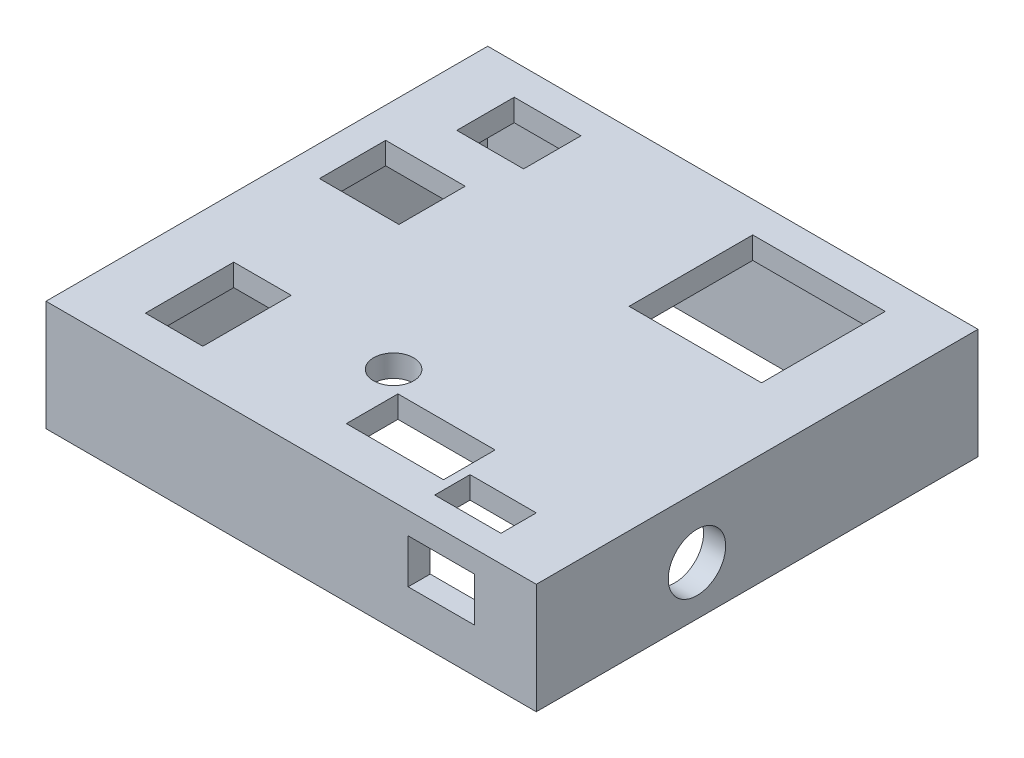
from build123d import *

# Parameters (mm, degrees)
SKETCH1_W           = 111
SKETCH1_H           = 100
BOSS_EXTRUDE1_DEPTH = 25
SKETCH2_W           = 101
SKETCH2_H           = 90
CUT_EXTRUDE1_DEPTH  = 20
SKETCH3_W           = 22
SKETCH3_H           = 11.672445945
CUT_EXTRUDE2_DEPTH  = 20
SKETCH4_W           = 15
SKETCH4_H           = 8
CUT_EXTRUDE3_DEPTH  = 20
SKETCH5_W           = 18
SKETCH5_H           = 15
CUT_EXTRUDE4_DEPTH  = 20
SKETCH6_W           = 15.121270519
SKETCH6_H           = 13
CUT_EXTRUDE5_DEPTH  = 20
SKETCH7_W           = 30
SKETCH7_H           = 28
CUT_EXTRUDE6_DEPTH  = 20
SKETCH8_R           = 4.533684
CUT_EXTRUDE7_DEPTH  = 20
SKETCH9_W           = 13
SKETCH9_H           = 20
CUT_EXTRUDE8_DEPTH  = 20
SKETCH10_R          = 6.5
CUT_EXTRUDE10_DEPTH = 20
SKETCH11_W          = 15.022741717
SKETCH11_H          = 10
CUT_EXTRUDE11_DEPTH = 20


with BuildPart() as part:
    # Sketch1 → Boss-Extrude1 (new body)
    with BuildSketch(Plane(origin=(0, 0, 0), x_dir=(1, 0, 0), z_dir=(0, 1, 0))):
        with Locations((-42.348341232, -8.130331754)):
            Rectangle(SKETCH1_W, SKETCH1_H)
    extrude(amount=BOSS_EXTRUDE1_DEPTH)

    # Sketch2 → Cut-Extrude1 (cut)
    with BuildSketch(Plane.XZ):
        with Locations((-42.348341232, 8.130331754)):
            Rectangle(SKETCH2_W, SKETCH2_H)
    extrude(amount=-CUT_EXTRUDE1_DEPTH, mode=Mode.SUBTRACT)

    # Sketch3 → Cut-Extrude2 (cut)
    with BuildSketch(Plane.XZ.offset(-20)):
        with Locations((-28.848341232, 42.294108782)):
            Rectangle(SKETCH3_W, SKETCH3_H)
    extrude(amount=-CUT_EXTRUDE2_DEPTH, mode=Mode.SUBTRACT)

    # Sketch4 → Cut-Extrude3 (cut)
    with BuildSketch(Plane.XZ.offset(-20)):
        with Locations((-8.348341232, 48.130331754)):
            Rectangle(SKETCH4_W, SKETCH4_H)
    extrude(amount=-CUT_EXTRUDE3_DEPTH, mode=Mode.SUBTRACT)

    # Sketch5 → Cut-Extrude4 (cut)
    with BuildSketch(Plane(origin=(0, 20, 0), x_dir=(-1, 0, 0), z_dir=(0, -1, 0))):
        with Locations((81.940531526, 4.369668246)):
            Rectangle(SKETCH5_W, SKETCH5_H)
    extrude(amount=-CUT_EXTRUDE4_DEPTH, mode=Mode.SUBTRACT)

    # Sketch6 → Cut-Extrude5 (cut)
    with BuildSketch(Plane.XZ.offset(-20)):
        with Locations((-77.287705973, -28.369668246)):
            Rectangle(SKETCH6_W, SKETCH6_H)
    extrude(amount=-CUT_EXTRUDE5_DEPTH, mode=Mode.SUBTRACT)

    # Sketch7 → Cut-Extrude6 (cut)
    with BuildSketch(Plane(origin=(0, 20, 0), x_dir=(-1, 0, 0), z_dir=(0, -1, 0))):
        with Locations((15.848341232, 20.869668246)):
            Rectangle(SKETCH7_W, SKETCH7_H)
    extrude(amount=-CUT_EXTRUDE6_DEPTH, mode=Mode.SUBTRACT)

    # Sketch8 → Cut-Extrude7 (cut)
    with BuildSketch(Plane.XZ.offset(-20)):
        with Locations((-45.155747809, 32.130331754)):
            Circle(SKETCH8_R)
    extrude(amount=-CUT_EXTRUDE7_DEPTH, mode=Mode.SUBTRACT)

    # Sketch9 → Cut-Extrude8 (cut)
    with BuildSketch(Plane.XZ.offset(-20)):
        with Locations((-77.761287907, 39.214530626)):
            Rectangle(SKETCH9_W, SKETCH9_H)
    extrude(amount=-CUT_EXTRUDE8_DEPTH, mode=Mode.SUBTRACT)

    # Sketch10 → Cut-Extrude10 (cut)
    with BuildSketch(Plane(origin=(13.151658768, 0, 0), x_dir=(0, 0, -1), z_dir=(1, 0, 0))):
        with Locations((-21.758345524, 11.101496307)):
            Circle(SKETCH10_R)
    extrude(amount=-CUT_EXTRUDE10_DEPTH, mode=Mode.SUBTRACT)

    # Sketch11 → Cut-Extrude11 (cut)
    with BuildSketch(Plane(origin=(0, 0, 53.130331754), x_dir=(-1, 0, 0), z_dir=(0, 0, -1))):
        with Locations((8.34551656, 15)):
            Rectangle(SKETCH11_W, SKETCH11_H)
    extrude(amount=-CUT_EXTRUDE11_DEPTH, mode=Mode.SUBTRACT)


solid = part.part
